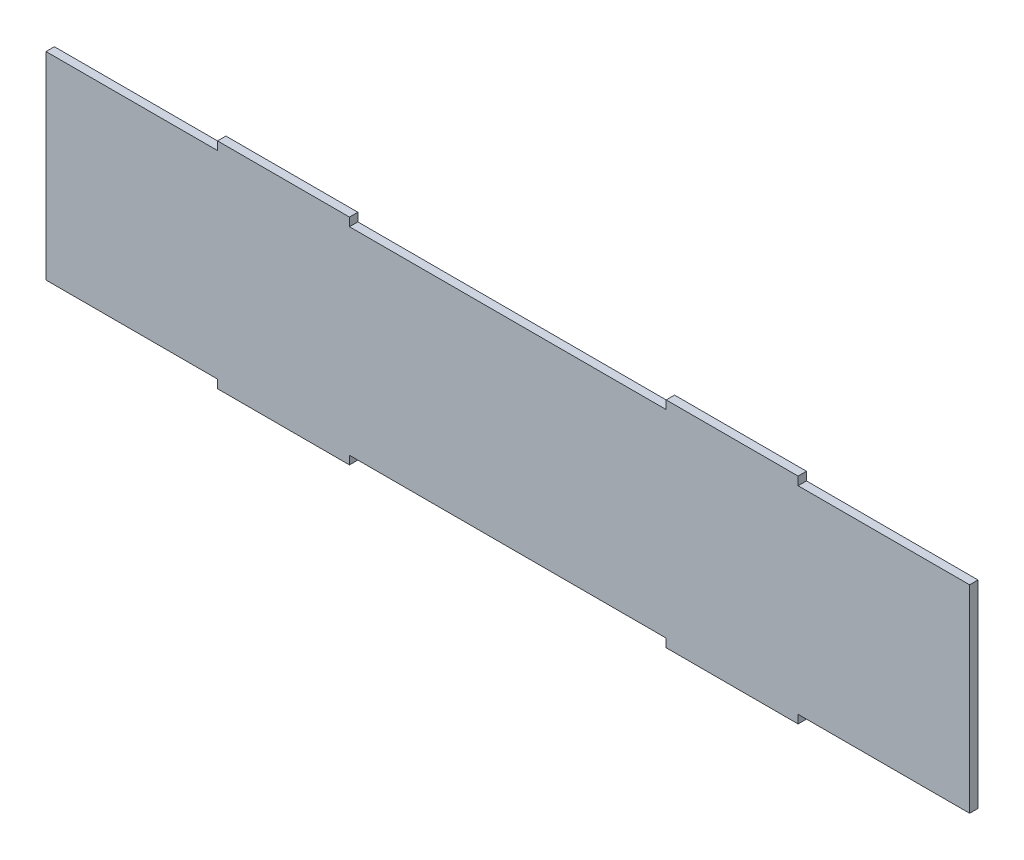
from build123d import *

# Parameters (mm, degrees)
BOSS_EXTRUDE1_DEPTH = 3.175


with BuildPart() as part:
    # Sketch2 → Boss-Extrude1 (new body)
    with BuildSketch(Plane.XY):
        Polygon((0, 0), (65, 0), (65, -3.175), (115, -3.175), (115, 0), (235, 0), (235, -3.175), (285, -3.175), (285, 0), (350, 0), (350, 75), (285, 75), (285, 78.175), (235, 78.175), (235, 75), (115, 75), (115, 78.175), (65, 78.175), (65, 75), (0, 75), align=None)
    extrude(amount=BOSS_EXTRUDE1_DEPTH)


solid = part.part
